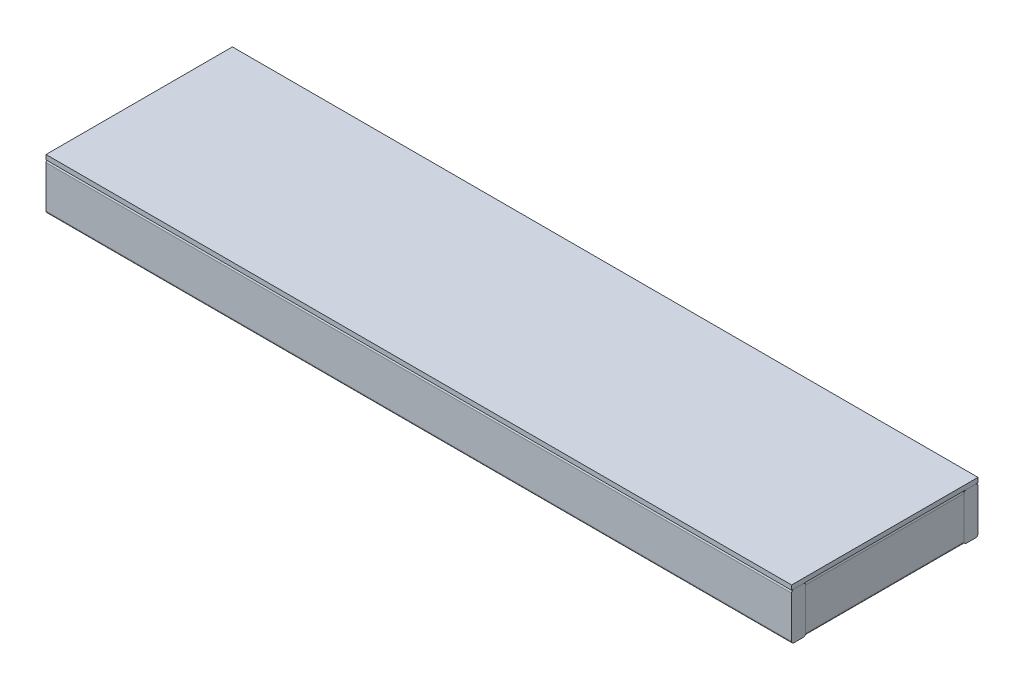
from build123d import *

# Parameters (mm, degrees)
PROFILE_START           = -508
PROFILE_1_X_3_1_DEPTH   = 1016
PROFILE_START_2         = -107.95
PROFILE_1_X_3_1_2_DEPTH = 215.9
PROFILE_2_X_4_9_DEPTH   = 215.9
PROFILE_2_X_4_9_2_DEPTH = 215.9
PROFILE_2_X_4_9_3_DEPTH = 215.9
SKETCH117_W             = 254
SKETCH117_H             = 254
SKETCH117_W_2           = 254.10095092
SKETCH117_W_3           = 253.89904908
SKETCH117_W_4           = 12.7
SKETCH117_H_2           = 215.9
BOSS_EXTRUDE2_DEPTH     = 6.35


# Read off the part's stored shape, not the designer's step: Profile 1 X 3(1)
with BuildPart() as part:
    # Profile 1 X 3(1) outline → Profile 1 X 3(1) (new body)
    with BuildSketch(Plane.YZ.offset(PROFILE_START)):
        with BuildLine():
            Line((3.175, -127), (60.325, -127))
            ThreePointArc((60.325, -127), (62.57006403, -126.07006403), (63.5, -123.825))
            Line((63.5, -123.825), (63.5, -111.125))
            ThreePointArc((63.5, -111.125), (62.57006403, -108.87993597), (60.325, -107.95))
            Line((60.325, -107.95), (3.175, -107.95))
            ThreePointArc((3.175, -107.95), (0.92993597, -108.87993597), (0, -111.125))
            Line((0, -111.125), (0, -123.825))
            ThreePointArc((0, -123.825), (0.92993597, -126.07006403), (3.175, -127))
        make_face()
        with BuildLine():
            Line((3.175, 107.95), (60.325, 107.95))
            ThreePointArc((60.325, 107.95), (62.57006403, 108.87993597), (63.5, 111.125))
            Line((63.5, 111.125), (63.5, 123.825))
            ThreePointArc((63.5, 123.825), (62.57006403, 126.07006403), (60.325, 127))
            Line((60.325, 127), (3.175, 127))
            ThreePointArc((3.175, 127), (0.92993597, 126.07006403), (0, 123.825))
            Line((0, 123.825), (0, 111.125))
            ThreePointArc((0, 111.125), (0.92993597, 108.87993597), (3.175, 107.95))
        make_face()
    extrude(amount=PROFILE_1_X_3_1_DEPTH)


with BuildPart() as body_2:
    # Profile 1 X 3_1 2 outline → Profile 1 X 3_1 2 (new body)
    with BuildSketch(Plane.XY.offset(PROFILE_START_2)):
        with BuildLine():
            Line((504.825, 63.5), (492.125, 63.5))
            ThreePointArc((492.125, 63.5), (489.87993597, 62.57006403), (488.95, 60.325))
            Line((488.95, 60.325), (488.95, 3.175))
            ThreePointArc((488.95, 3.175), (489.87993597, 0.92993597), (492.125, 0))
            Line((492.125, 0), (504.825, 0))
            ThreePointArc((504.825, 0), (507.07006403, 0.92993597), (508, 3.175))
            Line((508, 3.175), (508, 60.325))
            ThreePointArc((508, 60.325), (507.07006403, 62.57006403), (504.825, 63.5))
        make_face()
        with BuildLine():
            Line((-492.125, 63.5), (-504.825, 63.5))
            ThreePointArc((-504.825, 63.5), (-507.07006403, 62.57006403), (-508, 60.325))
            Line((-508, 60.325), (-508, 3.175))
            ThreePointArc((-508, 3.175), (-507.07006403, 0.92993597), (-504.825, 0))
            Line((-504.825, 0), (-492.125, 0))
            ThreePointArc((-492.125, 0), (-489.87993597, 0.92993597), (-488.95, 3.175))
            Line((-488.95, 3.175), (-488.95, 60.325))
            ThreePointArc((-488.95, 60.325), (-489.87993597, 62.57006403), (-492.125, 63.5))
        make_face()
    extrude(amount=PROFILE_1_X_3_1_2_DEPTH)


with BuildPart() as body_3:
    # Sketch116 → Profile 2 X 4(9) (new body)
    with BuildSketch(Plane(origin=(-273.05, 0, -107.95), x_dir=(1, 0, 0), z_dir=(0, 0, 1))):
        with BuildLine():
            Line((3.175, 0), (34.925, 0))
            ThreePointArc((34.925, 0), (37.17006403, 0.92993597), (38.1, 3.175))
            Line((38.1, 3.175), (38.1, 60.325))
            ThreePointArc((38.1, 60.325), (37.17006403, 62.57006403), (34.925, 63.5))
            Line((34.925, 63.5), (3.175, 63.5))
            ThreePointArc((3.175, 63.5), (0.92993597, 62.57006403), (0, 60.325))
            Line((0, 60.325), (0, 3.175))
            ThreePointArc((0, 3.175), (0.92993597, 0.92993597), (3.175, 0))
        make_face()
    extrude(amount=PROFILE_2_X_4_9_DEPTH)


with BuildPart() as body_4:
    # Sketch116 on segment 2 (carried to segment 2) → Profile 2 X 4_9 2 (new body)
    with BuildSketch(Plane(origin=(-19.05, 0, -107.95), x_dir=(1, 0, 0), z_dir=(0, 0, 1))):
        with BuildLine():
            Line((3.175, 0), (34.925, 0))
            ThreePointArc((34.925, 0), (37.17006403, 0.92993597), (38.1, 3.175))
            Line((38.1, 3.175), (38.1, 60.325))
            ThreePointArc((38.1, 60.325), (37.17006403, 62.57006403), (34.925, 63.5))
            Line((34.925, 63.5), (3.175, 63.5))
            ThreePointArc((3.175, 63.5), (0.92993597, 62.57006403), (0, 60.325))
            Line((0, 60.325), (0, 3.175))
            ThreePointArc((0, 3.175), (0.92993597, 0.92993597), (3.175, 0))
        make_face()
    extrude(amount=PROFILE_2_X_4_9_2_DEPTH)


with BuildPart() as body_5:
    # Sketch116 on segment 3 (carried to segment 3) → Profile 2 X 4_9 3 (new body)
    with BuildSketch(Plane(origin=(234.95, 0, -107.95), x_dir=(1, 0, 0), z_dir=(0, 0, 1))):
        with BuildLine():
            Line((3.175, 0), (34.925, 0))
            ThreePointArc((34.925, 0), (37.17006403, 0.92993597), (38.1, 3.175))
            Line((38.1, 3.175), (38.1, 60.325))
            ThreePointArc((38.1, 60.325), (37.17006403, 62.57006403), (34.925, 63.5))
            Line((34.925, 63.5), (3.175, 63.5))
            ThreePointArc((3.175, 63.5), (0.92993597, 62.57006403), (0, 60.325))
            Line((0, 60.325), (0, 3.175))
            ThreePointArc((0, 3.175), (0.92993597, 0.92993597), (3.175, 0))
        make_face()
    extrude(amount=PROFILE_2_X_4_9_3_DEPTH)


with BuildPart() as body_6:
    # Sketch117 → Boss-Extrude2 (new body)
    # profile 1 of 5: a face of its own
    with BuildSketch(Plane(origin=(0, 63.5, 0), x_dir=(1, 0, 0), z_dir=(0, 1, 0))):
        with Locations((-127.10095092, 0)):
            Rectangle(SKETCH117_W, SKETCH117_H)
    # profile 2 of 5: a face of its own
    with BuildSketch(Plane(origin=(0, 63.5, 0), x_dir=(1, 0, 0), z_dir=(0, 1, 0))):
        with Locations((126.89904908, 0)):
            Rectangle(SKETCH117_W, SKETCH117_H)
    # profile 3 of 5: a face of its own
    with BuildSketch(Plane(origin=(0, 63.5, 0), x_dir=(1, 0, 0), z_dir=(0, 1, 0))):
        with Locations((380.94952454, 0)):
            Rectangle(SKETCH117_W_2, SKETCH117_H)
    # profile 4 of 5: a face of its own
    with BuildSketch(Plane(origin=(0, 63.5, 0), x_dir=(1, 0, 0), z_dir=(0, 1, 0))):
        with Locations((-381.05047546, 0)):
            Rectangle(SKETCH117_W_3, SKETCH117_H)
        with Locations((-498.475, 0)):
            Rectangle(SKETCH117_W_4, SKETCH117_H_2, mode=Mode.SUBTRACT)
    # profile 5 of 5: a face of its own
    with BuildSketch(Plane(origin=(0, 63.5, 0), x_dir=(1, 0, 0), z_dir=(0, 1, 0))):
        with Locations((-498.475, 0)):
            Rectangle(SKETCH117_W_4, SKETCH117_H_2)
    extrude(amount=BOSS_EXTRUDE2_DEPTH)


solid = Compound([part.part, body_2.part, body_3.part, body_4.part, body_5.part, body_6.part])
